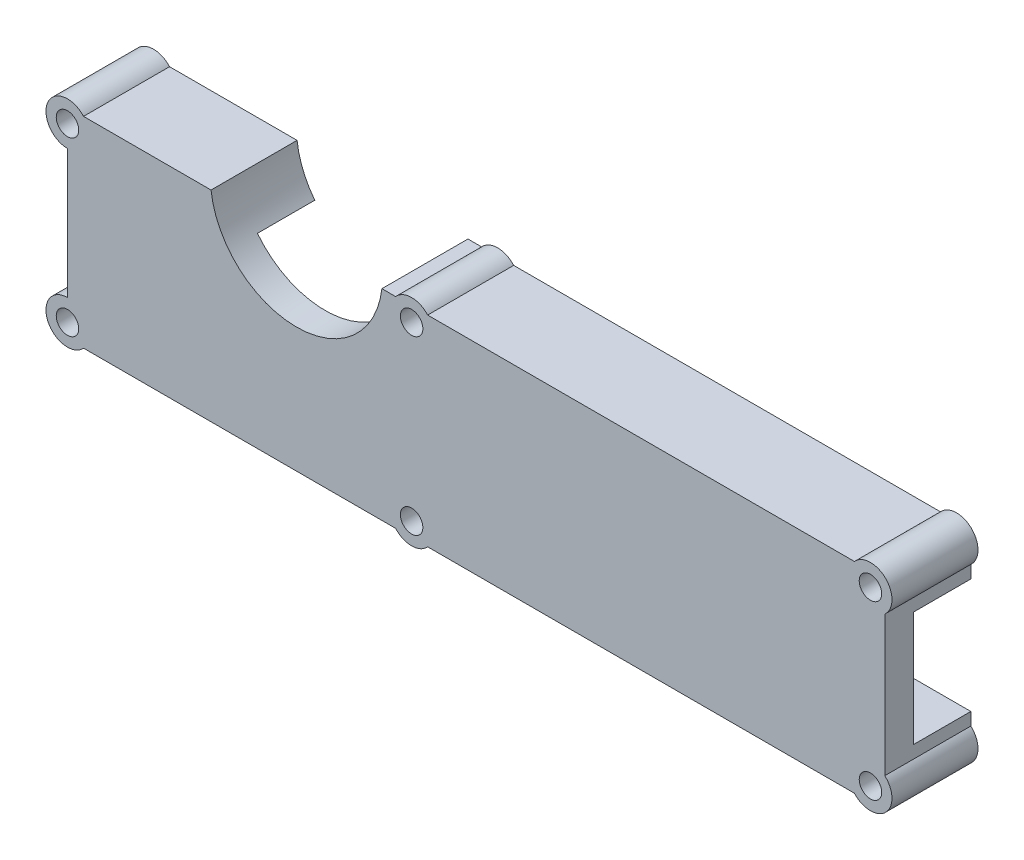
from build123d import *

# Parameters (mm, degrees)
SKETCH1_R           = 2.4892
BOSS_EXTRUDE1_DEPTH = 19.05
SKETCH2_W           = 12.7
SKETCH2_H           = 25.4
CUT_EXTRUDE1_DEPTH  = 189.491810996


with BuildPart() as part:
    # Sketch1 → Boss-Extrude1 (new body)
    with BuildSketch(Plane.XY):
        with BuildLine():
            ThreePointArc((-3.549757914, -3.175), (0, -4.7625), (3.549757914, -3.175))
            Line((3.549757914, -3.175), (98.050242086, -3.175))
            ThreePointArc((98.050242086, -3.175), (104.967596045, -3.367596045), (104.775, 3.549757914))
            Line((104.775, 3.549757914), (104.775, 34.550242086))
            ThreePointArc((104.775, 34.550242086), (104.967596045, 41.467596045), (98.050242086, 41.275))
            Line((98.050242086, 41.275), (3.549757914, 41.275))
            ThreePointArc((3.549757914, 41.275), (0, 42.8625), (-3.549757914, 41.275))
            Line((-3.549757914, 41.275), (-6.572897807, 41.275))
            ThreePointArc((-6.572897807, 41.275), (-25.49280779, 24.4475), (-44.412717773, 41.275))
            Line((-44.412717773, 41.275), (-72.650242086, 41.275))
            ThreePointArc((-72.650242086, 41.275), (-80.5475478, 40.044282483), (-76.2, 33.3375))
            Line((-76.2, 33.3375), (-76.2, 4.7625))
            ThreePointArc((-76.2, 4.7625), (-80.5475478, -1.944282483), (-72.650242086, -3.175))
            Line((-72.650242086, -3.175), (-3.549757914, -3.175))
        make_face()
        with Locations((-76.2, 0)):
            Circle(SKETCH1_R, mode=Mode.SUBTRACT)
        Circle(SKETCH1_R, mode=Mode.SUBTRACT)
        with Locations((-76.2, 38.1)):
            Circle(SKETCH1_R, mode=Mode.SUBTRACT)
        with Locations((0, 38.1)):
            Circle(SKETCH1_R, mode=Mode.SUBTRACT)
        with Locations((101.6, 38.1)):
            Circle(SKETCH1_R, mode=Mode.SUBTRACT)
        with Locations((101.6, 0)):
            Circle(SKETCH1_R, mode=Mode.SUBTRACT)
    extrude(amount=BOSS_EXTRUDE1_DEPTH)

    # Sketch2 → Cut-Extrude1 (cut, through all)
    with BuildSketch(Plane.ZY.offset(76.2)):
        with Locations((6.35, 19.05)):
            Rectangle(SKETCH2_W, SKETCH2_H)
    extrude(amount=-CUT_EXTRUDE1_DEPTH, mode=Mode.SUBTRACT)


solid = part.part
